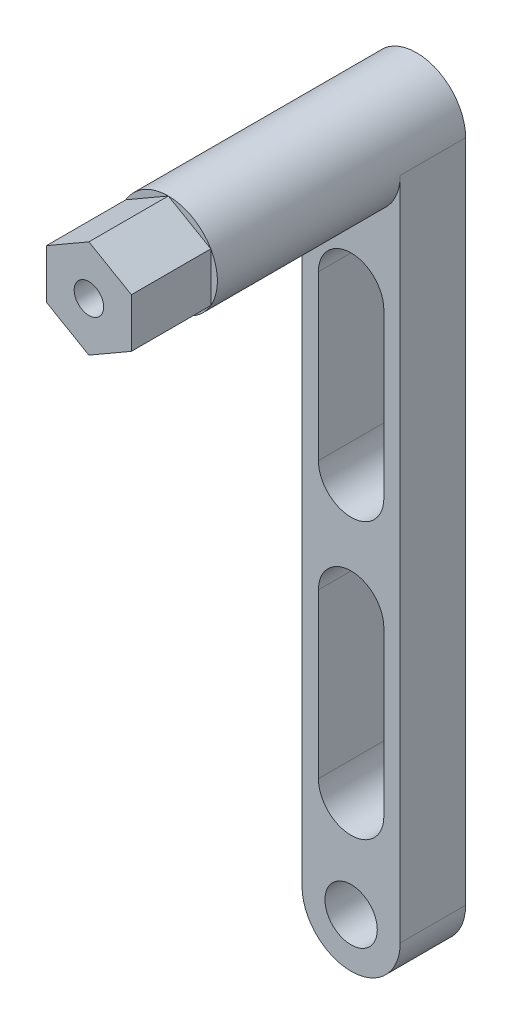
from build123d import *

# Parameters (mm, degrees)
SKETCH1_R           = 4
BOSS_EXTRUDE1_DEPTH = 10
BOSS_EXTRUDE2_DEPTH = 37.94
BOSS_EXTRUDE3_DEPTH = 12.14
SKETCH4_R           = 2.25
CUT_EXTRUDE1_DEPTH  = 10


with BuildPart() as part:
    # Sketch1 → Boss-Extrude1 (new body)
    with BuildSketch(Plane.XY):
        with BuildLine():
            Line((-7.5, 50.8), (-7.5, -50.8))
            ThreePointArc((-7.5, -50.8), (0, -58.3), (7.5, -50.8))
            Line((7.5, -50.8), (7.5, 50.8))
            ThreePointArc((7.5, 50.8), (0, 43.3), (-7.5, 50.8))
        make_face()
        with Locations((0, -50.8)):
            Circle(SKETCH1_R, mode=Mode.SUBTRACT)
        with BuildLine():
            ThreePointArc((5, -35.3), (0, -40.3), (-5, -35.3))
            Line((-5, -35.3), (-5, -10.3))
            ThreePointArc((-5, -10.3), (0, -5.3), (5, -10.3))
            Line((5, -10.3), (5, -35.3))
        make_face(mode=Mode.SUBTRACT)
        with BuildLine():
            ThreePointArc((-5, 31.8), (0, 36.8), (5, 31.8))
            Line((5, 31.8), (5, 6.8))
            ThreePointArc((5, 6.8), (0, 1.8), (-5, 6.8))
            Line((-5, 6.8), (-5, 31.8))
        make_face(mode=Mode.SUBTRACT)
    extrude(amount=BOSS_EXTRUDE1_DEPTH)

    # Sketch1<4> → Boss-Extrude2 (add)
    with BuildSketch(Plane.XY):
        with BuildLine():
            ThreePointArc((7.5, 50.8), (0, 58.3), (-7.5, 50.8))
            ThreePointArc((-7.5, 50.8), (0, 43.3), (7.5, 50.8))
        make_face()
    extrude(amount=BOSS_EXTRUDE2_DEPTH)

    # Sketch3 → Boss-Extrude3 (add)
    with BuildSketch(Plane.XY.offset(37.94)):
        Polygon((0, 43.3), (6.495190528, 47.05), (6.495190528, 54.55), (0, 58.3), (-6.495190528, 54.55), (-6.495190528, 47.05), align=None)
    extrude(amount=BOSS_EXTRUDE3_DEPTH)

    # Sketch4 → Cut-Extrude1 (cut)
    with BuildSketch(Plane.XY.offset(50.08)):
        with Locations((0, 50.8)):
            Circle(SKETCH4_R)
    extrude(amount=-CUT_EXTRUDE1_DEPTH, mode=Mode.SUBTRACT)


solid = part.part
